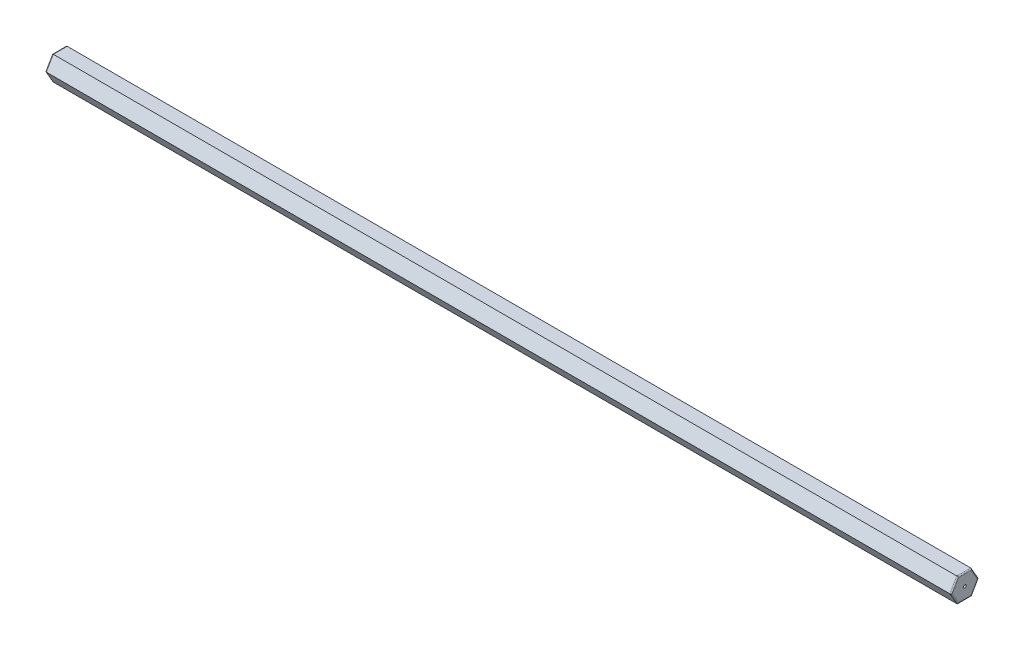
from build123d import *

# Parameters (mm, degrees)
BOSS_EXTRUDE1_DEPTH = 100.4824
FILLET1_R           = 0.127
SKETCH2_R           = 0.153628899
CUT_EXTRUDE1_DEPTH  = 0.254


with BuildPart() as part:
    # Sketch1 → Boss-Extrude1 (new body)
    with BuildSketch(Plane(origin=(0, 0, 0), x_dir=(0, 0, -1), z_dir=(1, 0, 0))):
        Polygon((1.539793168, 0), (0.769896584, 1.3335), (-0.769896584, 1.3335), (-1.539793168, 0), (-0.769896584, -1.3335), (0.769896584, -1.3335), align=None)
    extrude(amount=-BOSS_EXTRUDE1_DEPTH)

    # Fillet1
    fillet1_edges = [part.edges().sort_by_distance(p)[0] for p in [
        (0, -0.66675, 1.154844876),
        (0, -1.3335, 0),
        (0, -0.66675, -1.154844876),
        (0, 0.66675, -1.154844876),
        (0, 1.3335, 0),
        (0, 0.66675, 1.154844876),
        (-100.4824, -1.3335, 0),
        (-100.4824, -0.66675, -1.154844876),
        (-100.4824, 0.66675, -1.154844876),
        (-100.4824, 1.3335, 0),
        (-100.4824, 0.66675, 1.154844876),
        (-100.4824, -0.66675, 1.154844876),
    ]]
    fillet(fillet1_edges, radius=FILLET1_R)

    # Sketch2 → Cut-Extrude1 (cut)
    with BuildSketch(Plane(origin=(0, 0, 0), x_dir=(0, 0, -1), z_dir=(1, 0, 0))):
        Circle(SKETCH2_R)
    extrude(amount=-CUT_EXTRUDE1_DEPTH, mode=Mode.SUBTRACT)


solid = part.part
